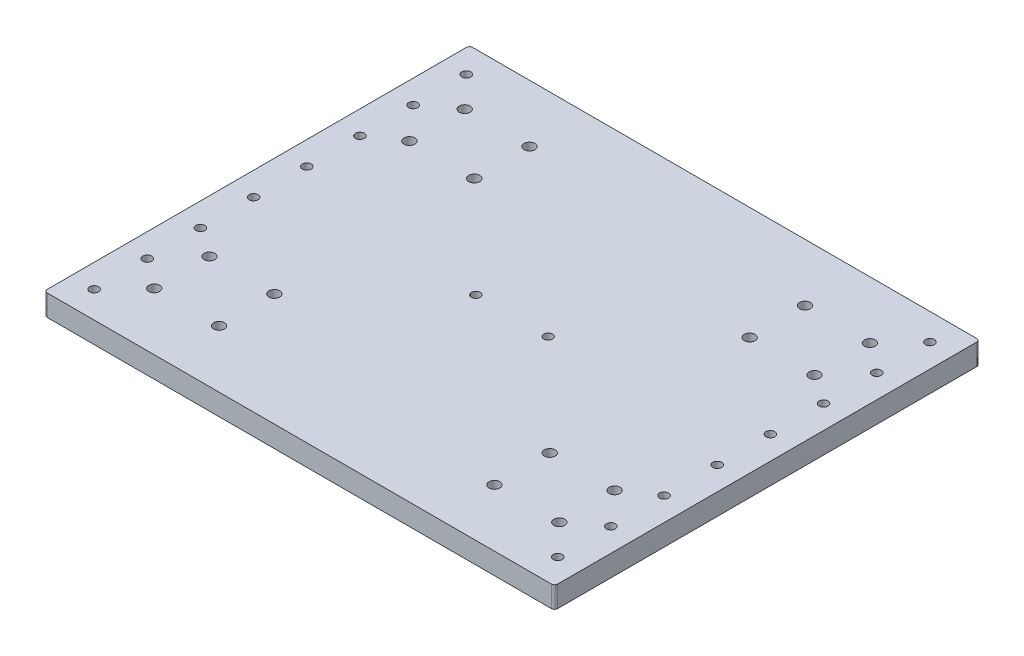
from build123d import *

# Parameters (mm, degrees)
SKETCH1_W             = 240
SKETCH1_H             = 200
BOSS_EXTRUDE1_DEPTH   = 5
SKETCH2_R             = 2.55
CUT_EXTRUDE1_DEPTH    = 157.524758425
SKETCH3_R             = 2.05
CUT_EXTRUDE2_DEPTH    = 157.524758425
M5X0_8_TAPPED_HOLE1_D = 4.2
FILLET1_R             = 1.5
LPATTERN2_COUNT       = 8
LPATTERN2_PITCH       = 25


with BuildPart() as part:
    # Sketch1 → Boss-Extrude1 (new, symmetric)
    with BuildSketch(Plane(origin=(0, 0, 0), x_dir=(1, 0, 0), z_dir=(0, 1, 0))):
        Rectangle(SKETCH1_W, SKETCH1_H)
    extrude(amount=BOSS_EXTRUDE1_DEPTH, both=True)

    # Sketch2 → Cut-Extrude1 (cut, through all)
    with BuildSketch(Plane(origin=(0, 5, 0), x_dir=(1, 0, 0), z_dir=(0, 1, 0))):
        with Locations((-95.25, 73)):
            Circle(SKETCH2_R)
        with Locations((-95.25, 47)):
            Circle(SKETCH2_R)
        with Locations((-64.75, 73)):
            Circle(SKETCH2_R)
        with Locations((-64.75, 47)):
            Circle(SKETCH2_R)
        with Locations((-95.25, -47)):
            Circle(SKETCH2_R)
        with Locations((-95.25, -73)):
            Circle(SKETCH2_R)
        with Locations((-64.75, -73)):
            Circle(SKETCH2_R)
        with Locations((-64.75, -47)):
            Circle(SKETCH2_R)
        with Locations((95.25, -47)):
            Circle(SKETCH2_R)
        with Locations((64.75, -47)):
            Circle(SKETCH2_R)
        with Locations((64.75, -73)):
            Circle(SKETCH2_R)
        with Locations((95.25, -73)):
            Circle(SKETCH2_R)
        with Locations((64.75, 73)):
            Circle(SKETCH2_R)
        with Locations((64.75, 47)):
            Circle(SKETCH2_R)
        with Locations((95.25, 73)):
            Circle(SKETCH2_R)
        with Locations((95.25, 47)):
            Circle(SKETCH2_R)
    extrude(amount=-CUT_EXTRUDE1_DEPTH, mode=Mode.SUBTRACT)

    # Sketch3 → Cut-Extrude2 (cut, through all)
    with BuildSketch(Plane(origin=(0, 5, 0), x_dir=(1, 0, 0), z_dir=(0, 1, 0))):
        with Locations((-17, 0)):
            Circle(SKETCH3_R)
        with Locations((17, 0)):
            Circle(SKETCH3_R)
    extrude(amount=-CUT_EXTRUDE2_DEPTH, mode=Mode.SUBTRACT)

    # M5x0.8 Tapped Hole1 (through all)
    with Locations(Plane(origin=(0, 5, 0), x_dir=(1, 0, 0), z_dir=(0, 1, 0))):
        with Locations((-109, 87.5), (109, 87.5)):
            m5x0_8_tapped_hole1 = Hole(M5X0_8_TAPPED_HOLE1_D / 2)

    # Fillet1
    fillet1_edges = [part.edges().sort_by_distance(p)[0] for p in [
        (-120, 0, -100),
        (120, 0, -100),
        (-120, 0, 100),
        (120, 0, 100),
    ]]
    fillet(fillet1_edges, radius=FILLET1_R)

    # LPattern2: M5x0.8 Tapped Hole1 ×8
    with Locations(*[(0, 0, i * LPATTERN2_PITCH) for i in range(1, LPATTERN2_COUNT)]):
        add(m5x0_8_tapped_hole1, mode=Mode.SUBTRACT)


solid = part.part
